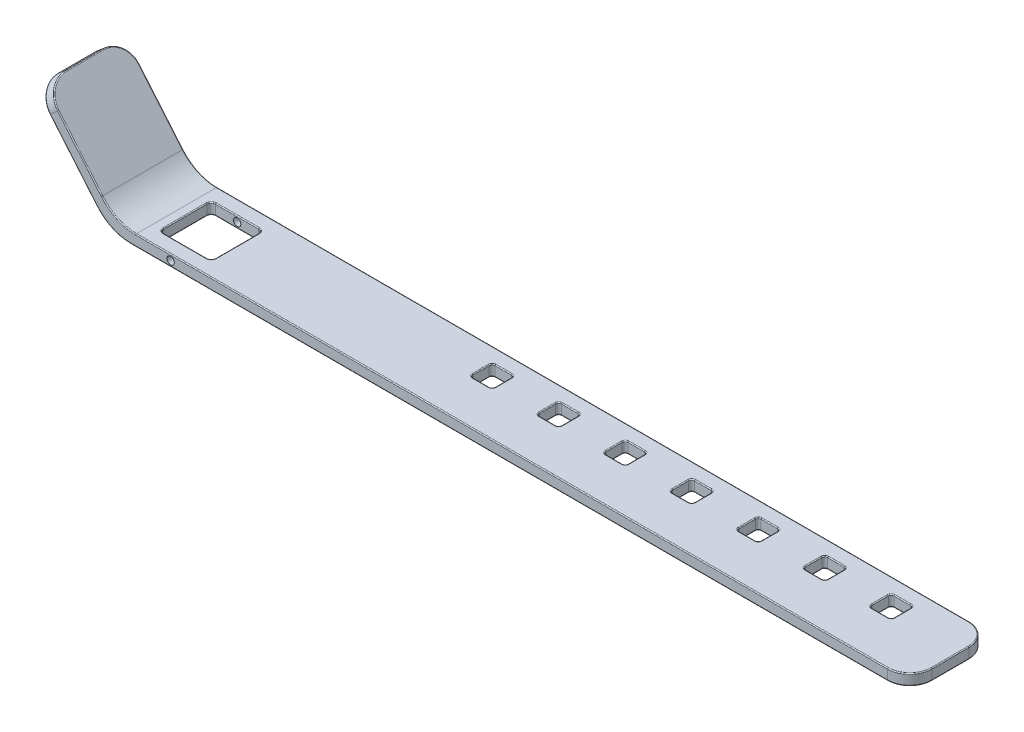
from build123d import *

# Parameters (mm, degrees)
BOSS_EXTRUDE1_DEPTH      = 11
BOSS_EXTRUDE1_DEPTH_BACK = 11
SKETCH2_R                = 1
FILLET1_R                = 6
CUT_EXTRUDE2_REACH       = 124.675
FILLET3_R                = 0.25


with BuildPart() as part:
    # Sketch2 → Boss-Extrude1 (new, two sides: drawn at the far end of the back side and taken through both)
    with BuildSketch(Plane.XY.offset(-BOSS_EXTRUDE1_DEPTH_BACK)):
        with BuildLine():
            Line((-98.59684142, 5.786548684), (-114.283628291, 24.481333294))
            Line((-114.283628291, 24.481333294), (-116.58176162, 22.552970465))
            Line((-116.58176162, 22.552970465), (-99.995764394, 2.786548684))
            ThreePointArc((-99.995764394, 2.786548684), (-95.874650217, -0.375693444), (-90.803231077, -1.5))
            Line((-90.803231077, -1.5), (120, -1.5))
            Line((120, -1.5), (120, 1.5))
            Line((120, 1.5), (-89.404308102, 1.5))
            ThreePointArc((-89.404308102, 1.5), (-94.475727243, 2.624306556), (-98.59684142, 5.786548684))
        make_face()
        with Locations((-80, 0)):
            Circle(SKETCH2_R, mode=Mode.SUBTRACT)
    extrude(amount=BOSS_EXTRUDE1_DEPTH + BOSS_EXTRUDE1_DEPTH_BACK)

    # Fillet1
    fillet1_edges = [part.edges().sort_by_distance(p)[0] for p in [
        (120, 0, 11),
        (120, 0, -11),
        (-115.432694955, 23.517151879, -11),
        (-115.432694955, 23.517151879, 11),
    ]]
    fillet(fillet1_edges, radius=FILLET1_R)

    # Sketch4 → Cut-Extrude2 (cut, up to next)
    with BuildSketch(Plane(origin=(0, 1.5, 0), x_dir=(1, 0, 0), z_dir=(0, 1, 0)), mode=Mode.PRIVATE) as cut_extrude2_sk1:
        with BuildLine():
            Line((-85.8, 7), (-74.2, 7))
            ThreePointArc((-74.2, 7), (-73.351471863, 6.648528137), (-73, 5.8))
            Line((-73, 5.8), (-73, -5.8))
            ThreePointArc((-73, -5.8), (-73.351471863, -6.648528137), (-74.2, -7))
            Line((-74.2, -7), (-85.8, -7))
            ThreePointArc((-85.8, -7), (-86.648528137, -6.648528137), (-87, -5.8))
            Line((-87, -5.8), (-87, 5.8))
            ThreePointArc((-87, 5.8), (-86.648528137, 6.648528137), (-85.8, 7))
        make_face()
    cut_extrude2_tool1 = extrude(cut_extrude2_sk1.sketch, amount=-CUT_EXTRUDE2_REACH, mode=Mode.PRIVATE) & part.part
    # Sketch4 → Cut-Extrude2 (cut, up to next)
    with BuildSketch(Plane(origin=(0, 1.5, 0), x_dir=(1, 0, 0), z_dir=(0, 1, 0)), mode=Mode.PRIVATE) as cut_extrude2_sk2:
        with BuildLine():
            Line((97.8, 7), (102.2, 7))
            ThreePointArc((102.2, 7), (102.765685425, 6.765685425), (103, 6.2))
            Line((103, 6.2), (103, 1.8))
            ThreePointArc((103, 1.8), (102.765685425, 1.234314575), (102.2, 1))
            Line((102.2, 1), (97.8, 1))
            ThreePointArc((97.8, 1), (97.234314575, 1.234314575), (97, 1.8))
            Line((97, 1.8), (97, 6.2))
            ThreePointArc((97, 6.2), (97.234314575, 6.765685425), (97.8, 7))
        make_face()
    cut_extrude2_tool2 = extrude(cut_extrude2_sk2.sketch, amount=-CUT_EXTRUDE2_REACH, mode=Mode.PRIVATE) & part.part
    # Sketch4 → Cut-Extrude2 (cut, up to next)
    with BuildSketch(Plane(origin=(0, 1.5, 0), x_dir=(1, 0, 0), z_dir=(0, 1, 0)), mode=Mode.PRIVATE) as cut_extrude2_sk3:
        with BuildLine():
            Line((79, 6.2), (79, 1.8))
            ThreePointArc((79, 1.8), (79.234314575, 1.234314575), (79.8, 1))
            Line((79.8, 1), (84.2, 1))
            ThreePointArc((84.2, 1), (84.765685425, 1.234314575), (85, 1.8))
            Line((85, 1.8), (85, 6.2))
            ThreePointArc((85, 6.2), (84.765685425, 6.765685425), (84.2, 7))
            Line((84.2, 7), (79.8, 7))
            ThreePointArc((79.8, 7), (79.234314575, 6.765685425), (79, 6.2))
        make_face()
    cut_extrude2_tool3 = extrude(cut_extrude2_sk3.sketch, amount=-CUT_EXTRUDE2_REACH, mode=Mode.PRIVATE) & part.part
    # Sketch4 → Cut-Extrude2 (cut, up to next)
    with BuildSketch(Plane(origin=(0, 1.5, 0), x_dir=(1, 0, 0), z_dir=(0, 1, 0)), mode=Mode.PRIVATE) as cut_extrude2_sk4:
        with BuildLine():
            Line((61, 6.2), (61, 1.8))
            ThreePointArc((61, 1.8), (61.234314575, 1.234314575), (61.8, 1))
            Line((61.8, 1), (66.2, 1))
            ThreePointArc((66.2, 1), (66.765685425, 1.234314575), (67, 1.8))
            Line((67, 1.8), (67, 6.2))
            ThreePointArc((67, 6.2), (66.765685425, 6.765685425), (66.2, 7))
            Line((66.2, 7), (61.8, 7))
            ThreePointArc((61.8, 7), (61.234314575, 6.765685425), (61, 6.2))
        make_face()
    cut_extrude2_tool4 = extrude(cut_extrude2_sk4.sketch, amount=-CUT_EXTRUDE2_REACH, mode=Mode.PRIVATE) & part.part
    # Sketch4 → Cut-Extrude2 (cut, up to next)
    with BuildSketch(Plane(origin=(0, 1.5, 0), x_dir=(1, 0, 0), z_dir=(0, 1, 0)), mode=Mode.PRIVATE) as cut_extrude2_sk5:
        with BuildLine():
            Line((43, 6.2), (43, 1.8))
            ThreePointArc((43, 1.8), (43.234314575, 1.234314575), (43.8, 1))
            Line((43.8, 1), (48.2, 1))
            ThreePointArc((48.2, 1), (48.765685425, 1.234314575), (49, 1.8))
            Line((49, 1.8), (49, 6.2))
            ThreePointArc((49, 6.2), (48.765685425, 6.765685425), (48.2, 7))
            Line((48.2, 7), (43.8, 7))
            ThreePointArc((43.8, 7), (43.234314575, 6.765685425), (43, 6.2))
        make_face()
    cut_extrude2_tool5 = extrude(cut_extrude2_sk5.sketch, amount=-CUT_EXTRUDE2_REACH, mode=Mode.PRIVATE) & part.part
    # Sketch4 → Cut-Extrude2 (cut, up to next)
    with BuildSketch(Plane(origin=(0, 1.5, 0), x_dir=(1, 0, 0), z_dir=(0, 1, 0)), mode=Mode.PRIVATE) as cut_extrude2_sk6:
        with BuildLine():
            Line((25, 6.2), (25, 1.8))
            ThreePointArc((25, 1.8), (25.234314575, 1.234314575), (25.8, 1))
            Line((25.8, 1), (30.2, 1))
            ThreePointArc((30.2, 1), (30.765685425, 1.234314575), (31, 1.8))
            Line((31, 1.8), (31, 6.2))
            ThreePointArc((31, 6.2), (30.765685425, 6.765685425), (30.2, 7))
            Line((30.2, 7), (25.8, 7))
            ThreePointArc((25.8, 7), (25.234314575, 6.765685425), (25, 6.2))
        make_face()
    cut_extrude2_tool6 = extrude(cut_extrude2_sk6.sketch, amount=-CUT_EXTRUDE2_REACH, mode=Mode.PRIVATE) & part.part
    # Sketch4 → Cut-Extrude2 (cut, up to next)
    with BuildSketch(Plane(origin=(0, 1.5, 0), x_dir=(1, 0, 0), z_dir=(0, 1, 0)), mode=Mode.PRIVATE) as cut_extrude2_sk7:
        with BuildLine():
            Line((7, 6.2), (7, 1.8))
            ThreePointArc((7, 1.8), (7.234314575, 1.234314575), (7.8, 1))
            Line((7.8, 1), (12.2, 1))
            ThreePointArc((12.2, 1), (12.765685425, 1.234314575), (13, 1.8))
            Line((13, 1.8), (13, 6.2))
            ThreePointArc((13, 6.2), (12.765685425, 6.765685425), (12.2, 7))
            Line((12.2, 7), (7.8, 7))
            ThreePointArc((7.8, 7), (7.234314575, 6.765685425), (7, 6.2))
        make_face()
    cut_extrude2_tool7 = extrude(cut_extrude2_sk7.sketch, amount=-CUT_EXTRUDE2_REACH, mode=Mode.PRIVATE) & part.part
    # Sketch4 → Cut-Extrude2 (cut, up to next)
    with BuildSketch(Plane(origin=(0, 1.5, 0), x_dir=(1, 0, 0), z_dir=(0, 1, 0)), mode=Mode.PRIVATE) as cut_extrude2_sk8:
        with BuildLine():
            Line((-11, 6.2), (-11, 1.8))
            ThreePointArc((-11, 1.8), (-10.765685425, 1.234314575), (-10.2, 1))
            Line((-10.2, 1), (-5.8, 1))
            ThreePointArc((-5.8, 1), (-5.234314575, 1.234314575), (-5, 1.8))
            Line((-5, 1.8), (-5, 6.2))
            ThreePointArc((-5, 6.2), (-5.234314575, 6.765685425), (-5.8, 7))
            Line((-5.8, 7), (-10.2, 7))
            ThreePointArc((-10.2, 7), (-10.765685425, 6.765685425), (-11, 6.2))
        make_face()
    cut_extrude2_tool8 = extrude(cut_extrude2_sk8.sketch, amount=-CUT_EXTRUDE2_REACH, mode=Mode.PRIVATE) & part.part
    add(cut_extrude2_tool1.solids().sort_by_distance((-80, 1.5, 0))[0], mode=Mode.SUBTRACT)
    add(cut_extrude2_tool2.solids().sort_by_distance((100, 1.5, -4))[0], mode=Mode.SUBTRACT)
    add(cut_extrude2_tool3.solids().sort_by_distance((82, 1.5, -4))[0], mode=Mode.SUBTRACT)
    add(cut_extrude2_tool4.solids().sort_by_distance((64, 1.5, -4))[0], mode=Mode.SUBTRACT)
    add(cut_extrude2_tool5.solids().sort_by_distance((46, 1.5, -4))[0], mode=Mode.SUBTRACT)
    add(cut_extrude2_tool6.solids().sort_by_distance((28, 1.5, -4))[0], mode=Mode.SUBTRACT)
    add(cut_extrude2_tool7.solids().sort_by_distance((10, 1.5, -4))[0], mode=Mode.SUBTRACT)
    add(cut_extrude2_tool8.solids().sort_by_distance((-8, 1.5, -4))[0], mode=Mode.SUBTRACT)

    # Fillet3
    fillet3_edges = [part.edges().sort_by_distance(p)[0] for p in [
        (-95.874650217, -0.375693444, -11),
        (-106.360400178, 10.371626245, -11),
        (-115.452152828, 21.206755128, -9.242640687),
        (-116.58176162, 22.552970465, 0),
        (-115.452152828, 21.206755128, 9.242640687),
        (-106.360400178, 10.371626245, 11),
        (-95.874650217, -0.375693444, 11),
        (-94.475727243, 2.624306556, -11),
        (-104.511872026, 12.835807659, -11),
        (-113.154019499, 23.135117957, -9.242640687),
        (-114.283628291, 24.481333294, 0),
        (-113.154019499, 23.135117957, 9.242640687),
        (-104.511872026, 12.835807659, 11),
        (-94.475727243, 2.624306556, 11),
        (-86.648528137, -1.5, -6.648528137),
        (-80, -1.5, -7),
        (-73.351471863, -1.5, -6.648528137),
        (-73, -1.5, 0),
        (-73.351471863, -1.5, 6.648528137),
        (-80, -1.5, 7),
        (-86.648528137, -1.5, 6.648528137),
        (-87, -1.5, 0),
        (118.242640687, -1.5, -9.242640687),
        (11.598384462, -1.5, -11),
        (11.598384462, -1.5, 11),
        (118.242640687, -1.5, 9.242640687),
        (120, -1.5, 0),
        (-11, -1.5, -4),
        (-10.765685425, -1.5, -6.765685425),
        (-8, -1.5, -7),
        (-5.234314575, -1.5, -6.765685425),
        (-5, -1.5, -4),
        (-5.234314575, -1.5, -1.234314575),
        (-8, -1.5, -1),
        (-10.765685425, -1.5, -1.234314575),
        (7, -1.5, -4),
        (7.234314575, -1.5, -6.765685425),
        (10, -1.5, -7),
        (12.765685425, -1.5, -6.765685425),
        (13, -1.5, -4),
        (12.765685425, -1.5, -1.234314575),
        (10, -1.5, -1),
        (7.234314575, -1.5, -1.234314575),
        (25, -1.5, -4),
        (25.234314575, -1.5, -6.765685425),
        (28, -1.5, -7),
        (30.765685425, -1.5, -6.765685425),
        (31, -1.5, -4),
        (30.765685425, -1.5, -1.234314575),
        (28, -1.5, -1),
        (25.234314575, -1.5, -1.234314575),
        (43, -1.5, -4),
        (43.234314575, -1.5, -6.765685425),
        (46, -1.5, -7),
        (48.765685425, -1.5, -6.765685425),
        (49, -1.5, -4),
        (48.765685425, -1.5, -1.234314575),
        (46, -1.5, -1),
        (43.234314575, -1.5, -1.234314575),
        (61, -1.5, -4),
        (61.234314575, -1.5, -6.765685425),
        (64, -1.5, -7),
        (66.765685425, -1.5, -6.765685425),
        (67, -1.5, -4),
        (66.765685425, -1.5, -1.234314575),
        (64, -1.5, -1),
        (61.234314575, -1.5, -1.234314575),
        (79, -1.5, -4),
        (79.234314575, -1.5, -6.765685425),
        (82, -1.5, -7),
        (84.765685425, -1.5, -6.765685425),
        (85, -1.5, -4),
        (84.765685425, -1.5, -1.234314575),
        (82, -1.5, -1),
        (79.234314575, -1.5, -1.234314575),
        (97, -1.5, -4),
        (97.234314575, -1.5, -6.765685425),
        (100, -1.5, -7),
        (102.765685425, -1.5, -6.765685425),
        (103, -1.5, -4),
        (102.765685425, -1.5, -1.234314575),
        (100, -1.5, -1),
        (97.234314575, -1.5, -1.234314575),
        (12.297845949, 1.5, -11),
        (118.242640687, 1.5, -9.242640687),
        (120, 1.5, 0),
        (118.242640687, 1.5, 9.242640687),
        (12.297845949, 1.5, 11),
        (-8, 1.5, -1),
        (-5.234314575, 1.5, -1.234314575),
        (-5, 1.5, -4),
        (-5.234314575, 1.5, -6.765685425),
        (-8, 1.5, -7),
        (-10.765685425, 1.5, -6.765685425),
        (-11, 1.5, -4),
        (-10.765685425, 1.5, -1.234314575),
        (10, 1.5, -1),
        (12.765685425, 1.5, -1.234314575),
        (13, 1.5, -4),
        (12.765685425, 1.5, -6.765685425),
        (10, 1.5, -7),
        (7.234314575, 1.5, -6.765685425),
        (7, 1.5, -4),
        (7.234314575, 1.5, -1.234314575),
        (28, 1.5, -1),
        (30.765685425, 1.5, -1.234314575),
        (31, 1.5, -4),
        (30.765685425, 1.5, -6.765685425),
        (28, 1.5, -7),
        (25.234314575, 1.5, -6.765685425),
        (25, 1.5, -4),
        (25.234314575, 1.5, -1.234314575),
        (46, 1.5, -1),
        (48.765685425, 1.5, -1.234314575),
        (49, 1.5, -4),
        (48.765685425, 1.5, -6.765685425),
        (46, 1.5, -7),
        (43.234314575, 1.5, -6.765685425),
        (43, 1.5, -4),
        (43.234314575, 1.5, -1.234314575),
        (64, 1.5, -1),
        (66.765685425, 1.5, -1.234314575),
        (67, 1.5, -4),
        (66.765685425, 1.5, -6.765685425),
        (64, 1.5, -7),
        (61.234314575, 1.5, -6.765685425),
        (61, 1.5, -4),
        (61.234314575, 1.5, -1.234314575),
        (82, 1.5, -1),
        (84.765685425, 1.5, -1.234314575),
        (85, 1.5, -4),
        (84.765685425, 1.5, -6.765685425),
        (82, 1.5, -7),
        (79.234314575, 1.5, -6.765685425),
        (79, 1.5, -4),
        (79.234314575, 1.5, -1.234314575),
        (100, 1.5, -1),
        (102.765685425, 1.5, -1.234314575),
        (103, 1.5, -4),
        (102.765685425, 1.5, -6.765685425),
        (100, 1.5, -7),
        (97.234314575, 1.5, -6.765685425),
        (97, 1.5, -4),
        (97.234314575, 1.5, -1.234314575),
        (-80, 1.5, 7),
        (-73.351471863, 1.5, 6.648528137),
        (-73, 1.5, 0),
        (-73.351471863, 1.5, -6.648528137),
        (-80, 1.5, -7),
        (-86.648528137, 1.5, -6.648528137),
        (-87, 1.5, 0),
        (-86.648528137, 1.5, 6.648528137),
    ]]
    fillet(fillet3_edges, radius=FILLET3_R)


solid = part.part
